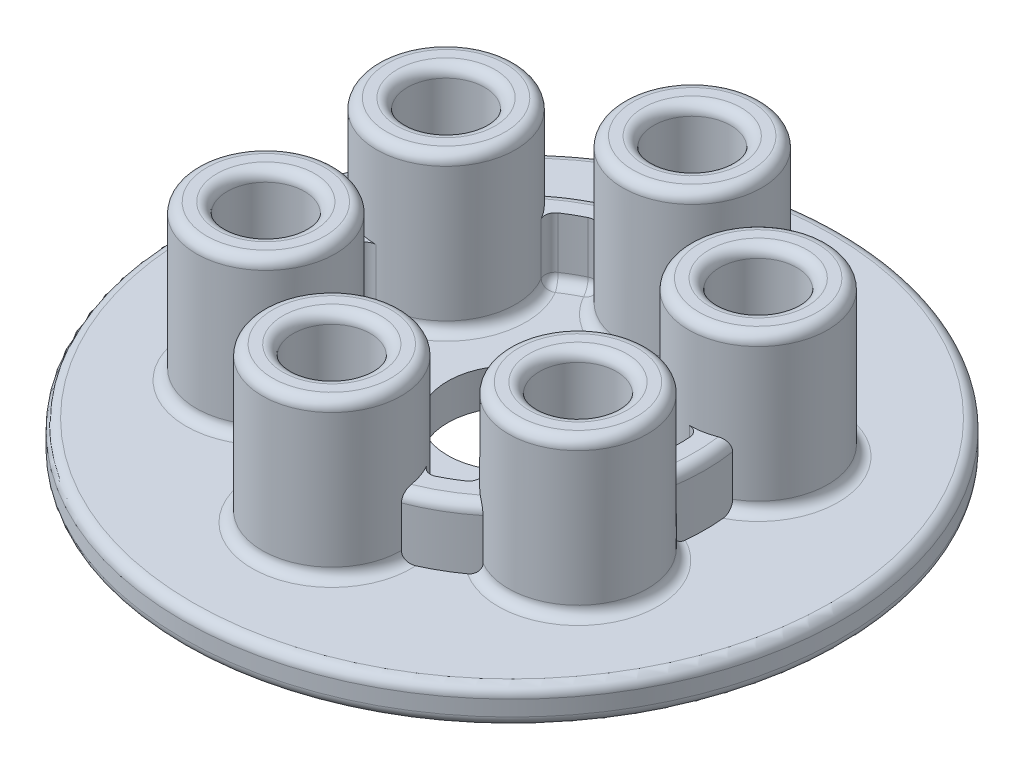
from build123d import *

# Parameters (mm, degrees)
SKETCH1_R                = 64
BOSS_EXTRUDE1_DEPTH      = 7
SKETCH2_R                = 37.5
SKETCH2_R_2              = 32.5
BOSS_EXTRUDE2_DEPTH      = 12
SKETCH3_R                = 12.5
CUT_EXTRUDE1_DEPTH       = 92.301697684
FILLET2_R                = 2
SKETCH4_R                = 13.5
BOSS_EXTRUDE3_DEPTH      = 30
SKETCH5_R                = 7.5
CUT_EXTRUDE2_DEPTH       = 98.780366193
FILLET3_R                = 2
CIRPATTERN2_COUNT        = 6
FILLET3_OF_CIRPATTERN2_R = 2
FILLET4_R                = 2


with BuildPart() as part:
    # Sketch1 → Boss-Extrude1 (new body)
    with BuildSketch(Plane(origin=(0, 0, 0), x_dir=(1, 0, 0), z_dir=(0, 1, 0))):
        with Locations(Location((0, 0, 0), (0, 0, 270))):
            Circle(SKETCH1_R)
    extrude(amount=BOSS_EXTRUDE1_DEPTH)

    # Sketch2 → Boss-Extrude2 (add)
    with BuildSketch(Plane(origin=(0, 7, 0), x_dir=(1, 0, 0), z_dir=(0, 1, 0))):
        with Locations(Location((0, 0, 0), (0, 0, 270))):
            Circle(SKETCH2_R)
        with Locations(Location((0, 0, 0), (0, 0, 270))):
            Circle(SKETCH2_R_2, mode=Mode.SUBTRACT)
    extrude(amount=BOSS_EXTRUDE2_DEPTH)

    # Sketch3 → Cut-Extrude1 (cut, through all)
    with BuildSketch(Plane(origin=(0, 7, 0), x_dir=(1, 0, 0), z_dir=(0, 1, 0))):
        with Locations(Location((0, 0, 0), (0, 0, 270))):
            Circle(SKETCH3_R)
    extrude(amount=-CUT_EXTRUDE1_DEPTH, mode=Mode.SUBTRACT)

    # Fillet2
    fillet2_edges = [part.edges().sort_by_distance(p)[0] for p in [
        (0, 0, -64),
        (0, 7, -64),
        (0, 19, -37.5),
    ]]
    fillet(fillet2_edges, radius=FILLET2_R)

    # Sketch4 → Boss-Extrude3 (add)
    with BuildSketch(Plane(origin=(0, 7, 0), x_dir=(1, 0, 0), z_dir=(0, 1, 0))):
        with Locations(Location((0, 35, 0), (0, 0, 359.939369671))):
            Circle(SKETCH4_R)
    boss_extrude3 = extrude(amount=BOSS_EXTRUDE3_DEPTH)

    # Sketch5 → Cut-Extrude2 (cut, through all)
    with BuildSketch(Plane(origin=(0, 37, 0), x_dir=(1, 0, 0), z_dir=(0, 1, 0))):
        with Locations(Location((0, 35, 0), (0, 0, 270))):
            Circle(SKETCH5_R)
    cut_extrude2 = extrude(amount=-CUT_EXTRUDE2_DEPTH, mode=Mode.SUBTRACT)

    # Fillet3
    fillet3_edges = [part.edges().sort_by_distance(p)[0] for p in [
        (12.534230681, 13, -29.985714286),
        (-12.534230681, 13, -29.985714286),
        (-13.499992441, 37, -35.014285682),
        (0, 0, -42.5),
        (0, 37, -42.5),
    ]]
    fillet(fillet3_edges, radius=FILLET3_R)

    # CirPattern2: Boss-Extrude3, Cut-Extrude2 ×6 about axis
    cirpattern2_axis = Axis((0, 0, 0), (0, 1, 0))
    add([boss_extrude3.rotate(cirpattern2_axis, i * 360 / CIRPATTERN2_COUNT) for i in range(1, CIRPATTERN2_COUNT)])
    add([cut_extrude2.rotate(cirpattern2_axis, i * 360 / CIRPATTERN2_COUNT) for i in range(1, CIRPATTERN2_COUNT)], mode=Mode.SUBTRACT)

    # Fillet3 of CirPattern2
    fillet3_of_cirpattern2_edges = [part.edges().sort_by_distance(p)[0] for p in [
        (-19.701274981, 13, -25.84781933),
        (-32.235505663, 13, -4.137894956),
        (-37.073257117, 37, -5.815806436),
        (-36.806079661, 0, -21.25),
        (-36.806079661, 37, -21.25),
        (-32.235505663, 13, 4.137894956),
        (-19.701274981, 13, 25.84781933),
        (-23.573264675, 37, 29.198479246),
        (-36.806079661, 0, 21.25),
        (-36.806079661, 37, 21.25),
        (-12.534230681, 13, 29.985714286),
        (12.534230681, 13, 29.985714286),
        (13.499992441, 37, 35.014285682),
        (0, 0, 42.5),
        (0, 37, 42.5),
        (19.701274981, 13, 25.84781933),
        (32.235505663, 13, 4.137894956),
        (37.073257117, 37, 5.815806436),
        (36.806079661, 0, 21.25),
        (36.806079661, 37, 21.25),
        (32.235505663, 13, -4.137894956),
        (19.701274981, 13, -25.84781933),
        (23.573264675, 37, -29.198479246),
        (36.806079661, 0, -21.25),
        (36.806079661, 37, -21.25),
    ]]
    fillet(fillet3_of_cirpattern2_edges, radius=FILLET3_OF_CIRPATTERN2_R)

    # Fillet4
    fillet4_edges = [part.edges().sort_by_distance(p)[0] for p in [
        (18.619546181, 7, -10.75),
        (31.795547625, 7, -3.465779277),
        (32.5, 7, 0),
        (31.79554762, 7, 3.465779282),
        (18.619546181, 7, 10.75),
        (18.89922671, 7, 25.802862332),
        (16.25, 7, 28.145825623),
        (12.896320908, 7, 29.268641607),
        (0, 7, 21.5),
        (-12.896320915, 7, 29.268641609),
        (-16.25, 7, 28.145825623),
        (-18.89922671, 7, 25.802862332),
        (-18.619546181, 7, 10.75),
        (-31.795547625, 7, 3.465779277),
        (-32.5, 7, 0),
        (-31.79554762, 7, -3.465779282),
        (-18.619546181, 7, -10.75),
        (-18.89922671, 7, -25.802862332),
        (-16.25, 7, -28.145825623),
        (-12.896320915, 7, -29.268641609),
        (0, 7, -21.5),
        (12.896320915, 7, -29.268641609),
        (16.25, 7, -28.145825623),
        (18.899226712, 7, -25.802862325),
    ]]
    fillet(fillet4_edges, radius=FILLET4_R - 0.0004)  # a hair under: the kernel refuses the full size
    fillet4_2_edges = [part.edges().sort_by_distance(p)[0] for p in [
        (42.002232075, 7, -24.250000014),
    ]]
    fillet(fillet4_2_edges, radius=FILLET4_R)
    fillet4_3_edges = [part.edges().sort_by_distance(p)[0] for p in [
        (42.002232092, 7, 24.249999986),
    ]]
    fillet(fillet4_3_edges, radius=FILLET4_R)
    fillet4_4_edges = [part.edges().sort_by_distance(p)[0] for p in [
        (1.6e-08, 7, 48.5),
    ]]
    fillet(fillet4_4_edges, radius=FILLET4_R)
    fillet4_5_edges = [part.edges().sort_by_distance(p)[0] for p in [
        (-42.002232075, 7, 24.250000014),
    ]]
    fillet(fillet4_5_edges, radius=FILLET4_R)
    fillet4_6_edges = [part.edges().sort_by_distance(p)[0] for p in [
        (-42.002232092, 7, -24.249999986),
    ]]
    fillet(fillet4_6_edges, radius=FILLET4_R)
    fillet4_7_edges = [part.edges().sort_by_distance(p)[0] for p in [
        (-1.6e-08, 7, -48.5),
    ]]
    fillet(fillet4_7_edges, radius=FILLET4_R)


solid = part.part
